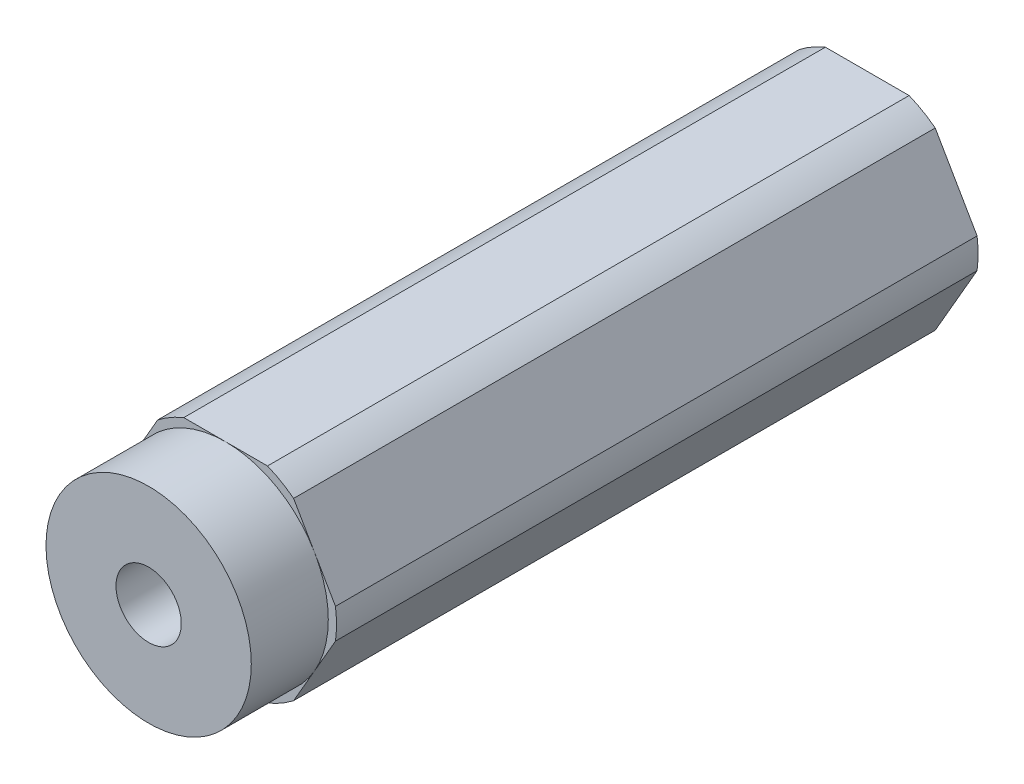
from build123d import *

# Parameters (mm, degrees)
SKETCH1_R           = 2.0193
BOSS_EXTRUDE1_DEPTH = 19.84375
SKETCH2_R           = 6.35
SKETCH2_R_2         = 2.0193
BOSS_EXTRUDE2_DEPTH = 4.7625


with BuildPart() as part:
    # Sketch1 → Boss-Extrude1 (new, symmetric)
    with BuildSketch(Plane.XY):
        with BuildLine():
            ThreePointArc((4.204110358, 5.41826726), (3.429, 5.939202219), (2.590301913, 6.35))
            Line((2.590301913, 6.35), (-2.590301913, 6.35))
            ThreePointArc((-2.590301913, 6.35), (-3.429, 5.939202219), (-4.204110358, 5.41826726))
            Line((-4.204110358, 5.41826726), (-6.79441227, 0.93173274))
            ThreePointArc((-6.79441227, 0.93173274), (-6.858, 0), (-6.79441227, -0.93173274))
            Line((-6.79441227, -0.93173274), (-4.204110358, -5.41826726))
            ThreePointArc((-4.204110358, -5.41826726), (-3.429, -5.939202219), (-2.590301913, -6.35))
            Line((-2.590301913, -6.35), (2.590301913, -6.35))
            ThreePointArc((2.590301913, -6.35), (3.429, -5.939202219), (4.204110358, -5.41826726))
            Line((4.204110358, -5.41826726), (6.79441227, -0.93173274))
            ThreePointArc((6.79441227, -0.93173274), (6.8420846, -0.466950024), (6.858, 0))
            ThreePointArc((6.858, 0), (6.8420846, 0.466950024), (6.79441227, 0.93173274))
            Line((6.79441227, 0.93173274), (4.204110358, 5.41826726))
        make_face()
        Circle(SKETCH1_R, mode=Mode.SUBTRACT)
    extrude(amount=BOSS_EXTRUDE1_DEPTH, both=True)

    # Sketch2 → Boss-Extrude2 (add, symmetric)
    with BuildSketch(Plane.XY.offset(19.84375)):
        Circle(SKETCH2_R)
        Circle(SKETCH2_R_2, mode=Mode.SUBTRACT)
    extrude(amount=BOSS_EXTRUDE2_DEPTH, both=True)


solid = part.part
